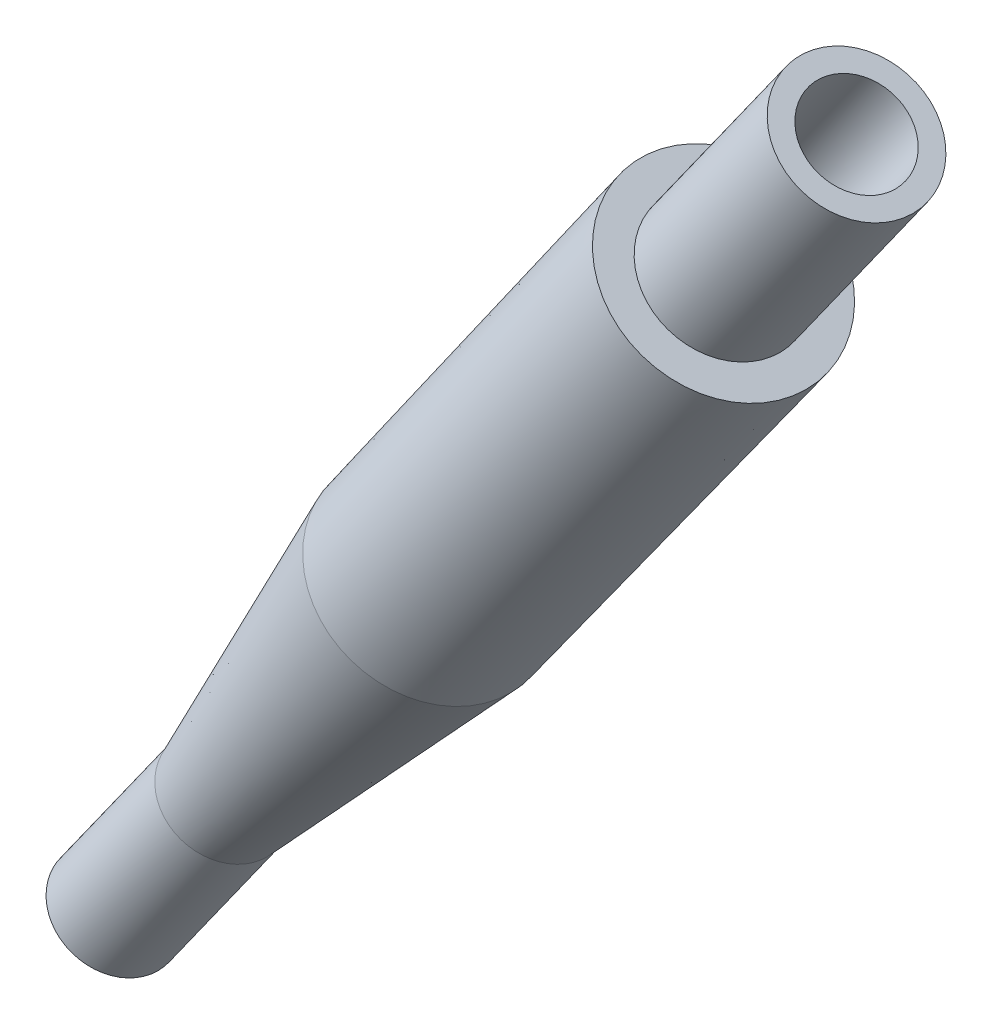
from build123d import *


with BuildPart() as part:
    # Sketch1 → Revolve1 (revolve)
    with BuildSketch(Plane(origin=(96.031948768, 24.259878967, -114.32637478), x_dir=(0.5797540183170993, 0.8147915550895066, 0), z_dir=(0, 0, -1))):
        Polygon((-201.145317806, 47.619722085), (-136.905317806, 47.619722085), (-136.905317806, 47.980853052), (-145.145317806, 47.980853052), (-145.145317806, 50.169722085), (-132.905317806, 50.169722085), (-132.905317806, 51.314722085), (-145.145317806, 51.314722085), (-145.145317806, 53.039722085), (-172.145317806, 52.884722085), (-191.145317806, 50.459722085), (-201.145317806, 50.459722085), align=None)
    revolve(axis=Axis((18.217289915, -167.239352557, -114.32637478), (0.5797540183170992, 0.8147915550895068, 0)))


solid = part.part
